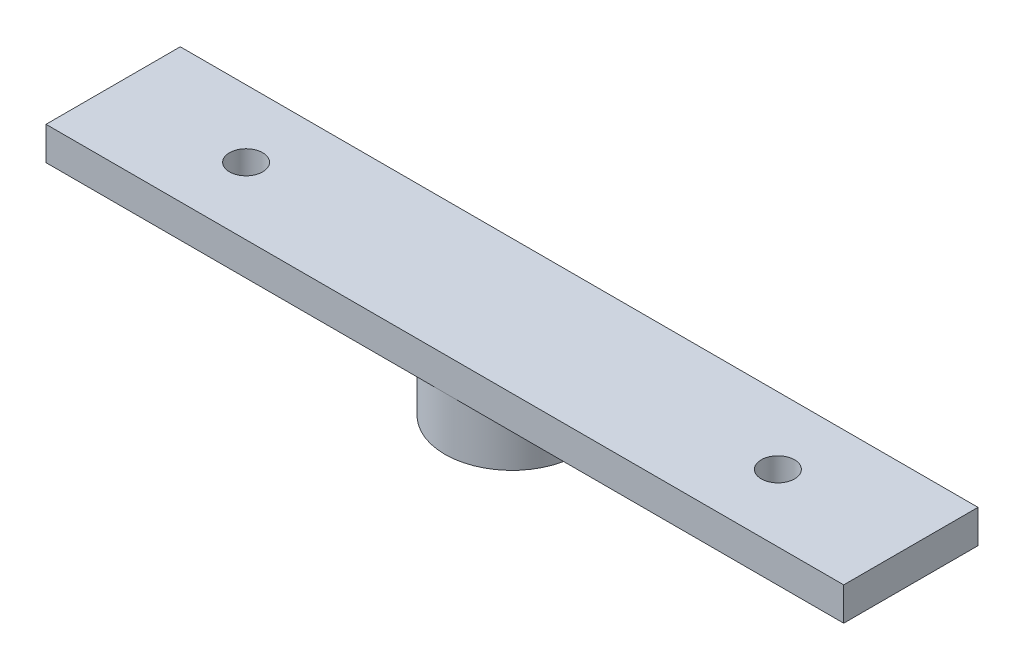
from build123d import *

# Parameters (mm, degrees)
SKETCH1_W           = 2
SKETCH1_H           = 4
SKETCH2_W           = 60
SKETCH2_H           = 10.1
BOSS_EXTRUDE1_DEPTH = 2.5
SKETCH3_R           = 1.25
CUT_EXTRUDE1_DEPTH  = 5


with BuildPart() as part:
    # Sketch1 → Revolve1 (revolve)
    with BuildSketch(Plane.XY):
        with Locations((4.05, 2)):
            Rectangle(SKETCH1_W, SKETCH1_H)
    revolve(axis=Axis((0, 97.022326023, 0), (0, -1, 0)))

    # Sketch2 → Boss-Extrude1 (add)
    with BuildSketch(Plane(origin=(0, 4, 0), x_dir=(1, 0, 0), z_dir=(0, 1, 0))):
        Rectangle(SKETCH2_W, SKETCH2_H)
    extrude(amount=BOSS_EXTRUDE1_DEPTH)

    # Sketch3 → Cut-Extrude1 (cut)
    with BuildSketch(Plane(origin=(0, 6.5, 0), x_dir=(1, 0, 0), z_dir=(0, 1, 0))):
        with Locations((-20, 0)):
            Circle(SKETCH3_R)
        with Locations((20, 0)):
            Circle(SKETCH3_R)
    extrude(amount=-CUT_EXTRUDE1_DEPTH, mode=Mode.SUBTRACT)


solid = part.part
